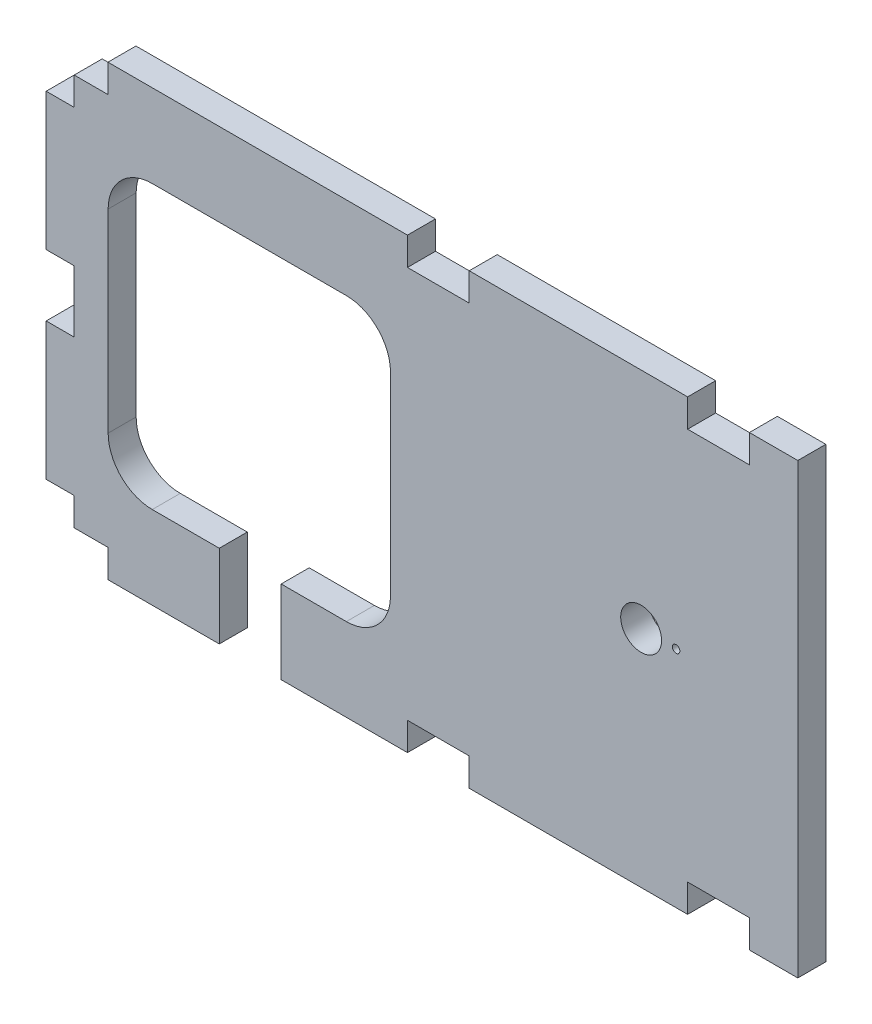
from build123d import *

# Parameters (mm, degrees)
SKETCH2_W           = 177.8
SKETCH2_H           = 101.6
BOSS_EXTRUDE3_DEPTH = 6.35
SKETCH3_R           = 4.635
CUT_EXTRUDE1_DEPTH  = 103.587389576
SKETCH7_W           = 14
SKETCH7_H           = 6.35
SKETCH7_W_2         = 6.35
SKETCH7_H_2         = 14
CUT_EXTRUDE2_DEPTH  = 103.587389576
SKETCH8_R           = 0.8509
SKETCH8_W           = 7.40992353
SKETCH8_H           = 101.6
CUT_EXTRUDE3_DEPTH  = 10
FILLET4_R           = 10


with BuildPart() as part:
    # Sketch2 → Boss-Extrude3 (new body)
    with BuildSketch(Plane.XY):
        Rectangle(SKETCH2_W, SKETCH2_H)
    extrude(amount=BOSS_EXTRUDE3_DEPTH)

    # Sketch3 → Cut-Extrude1 (cut, through all)
    with BuildSketch(Plane.XY.offset(6.35)):
        Polygon((-10.850825335, 32), (-74.850825335, 32), (-74.850825335, -32), (-49.659575094, -32), (-49.659575094, -50.8), (-35.627924906, -50.8), (-35.627924906, -32), (-10.850825335, -32), align=None)
        with Locations((45.9739194, 0)):
            Circle(SKETCH3_R)
    extrude(amount=-CUT_EXTRUDE1_DEPTH, mode=Mode.SUBTRACT)

    # Sketch7 → Cut-Extrude2 (cut, through all)
    with BuildSketch(Plane.XY.offset(6.35)):
        with Locations((63.509, 47.625)):
            Rectangle(SKETCH7_W, SKETCH7_H)
        Polygon((-88.9, 38.1), (-82.55, 38.1), (-82.55, 44.45), (-74.9, 44.45), (-74.9, 50.8), (-88.9, 50.8), align=None)
        with Locations((-85.725, 0)):
            Rectangle(SKETCH7_W_2, SKETCH7_H_2)
        Polygon((-82.55, -38.1), (-88.9, -38.1), (-88.9, -50.8), (-74.9, -50.8), (-74.9, -44.45), (-82.55, -44.45), align=None)
        with Locations((0, 47.625)):
            Rectangle(SKETCH7_W, SKETCH7_H)
        with Locations((63.509, -47.625)):
            Rectangle(SKETCH7_W, SKETCH7_H)
        with Locations((0, -47.625)):
            Rectangle(SKETCH7_W, SKETCH7_H)
    extrude(amount=-CUT_EXTRUDE2_DEPTH, mode=Mode.SUBTRACT)

    # Sketch8 → Cut-Extrude3 (cut)
    with BuildSketch(Plane.XY.offset(6.35)):
        with Locations((53.8987194, 0)):
            Circle(SKETCH8_R)
        with Locations((85.195038235, 0)):
            Rectangle(SKETCH8_W, SKETCH8_H)
    extrude(amount=-CUT_EXTRUDE3_DEPTH, mode=Mode.SUBTRACT)

    # Fillet4
    fillet4_edges = [part.edges().sort_by_distance(p)[0] for p in [
        (-10.850825335, 32, 3.175),
        (-74.850825335, 32, 3.175),
        (-10.850825335, -32, 3.175),
        (-74.850825335, -32, 3.175),
    ]]
    fillet(fillet4_edges, radius=FILLET4_R)


solid = part.part
